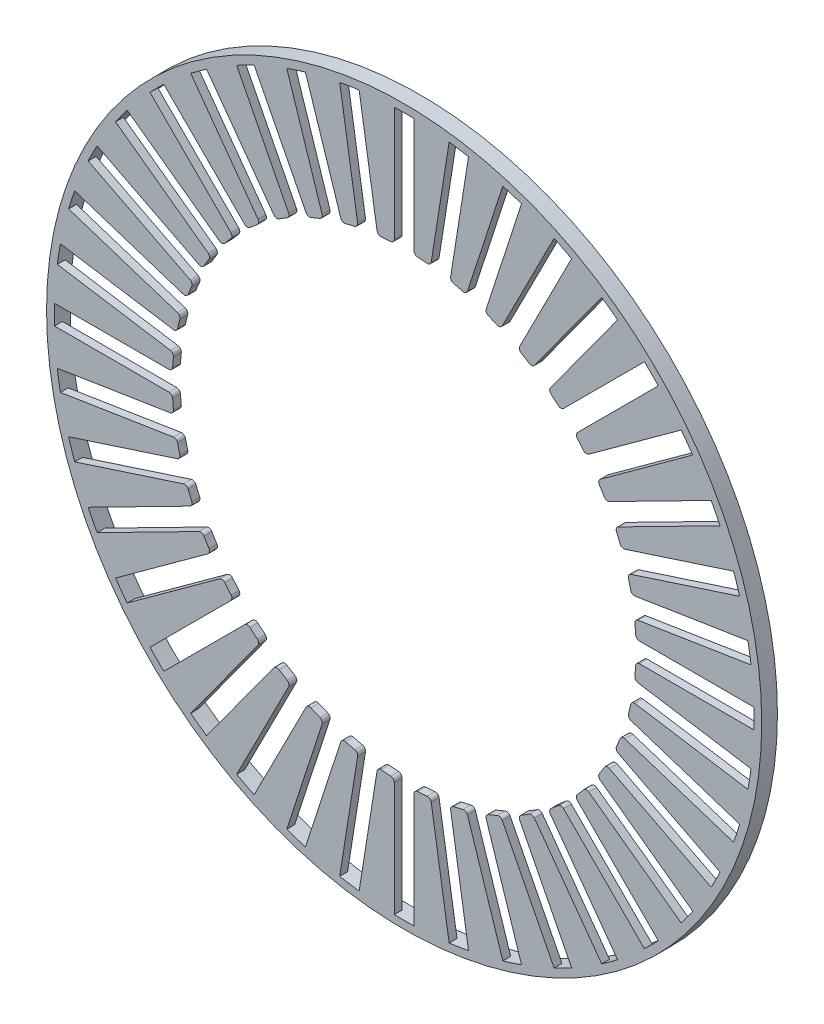
from build123d import *

# Parameters (mm, degrees)
ESQUISSE1_R        = 91
BOSS_EXTRU_1_DEPTH = 2
BOSS_EXTRU_2_START = -2
ESQUISSE1_3_R      = 91
BOSS_EXTRU_2_DEPTH = 2


with BuildPart() as part:
    # Esquisse1 → Boss.-Extru.1 (new body)
    with BuildSketch(Plane.XY):
        Circle(ESQUISSE1_R)
        with BuildLine():
            ThreePointArc((11.44795267, 88.260661564), (13.922667389, 87.904262313), (16.386394373, 87.478489239))
            Line((16.386394373, 87.478489239), (11.831455423, 58.719736546))
            ThreePointArc((11.831455423, 58.719736546), (11.997617886, 58.051361136), (12.556177327, 57.648438062))
            ThreePointArc((12.556177327, 57.648438062), (13.773276467, 57.369825303), (14.984207288, 57.065519641))
            ThreePointArc((14.984207288, 57.065519641), (15.664810641, 57.17094605), (16.116298566, 57.691036722))
            Line((16.116298566, 57.691036722), (25.114018752, 85.383172008))
            ThreePointArc((25.114018752, 85.383172008), (27.502512499, 84.64402995), (29.869301333, 83.838087036))
            Line((29.869301333, 83.838087036), (20.871581148, 56.14595175))
            ThreePointArc((20.871581148, 56.14595175), (20.931140925, 55.459811614), (21.419792516, 54.974471244))
            ThreePointArc((21.419792516, 54.974471244), (22.57832251, 54.508892418), (23.726740869, 54.018901949))
            ThreePointArc((23.726740869, 54.018901949), (24.415457189, 54.016560562), (24.942746655, 54.459619782))
            Line((24.942746655, 54.459619782), (38.161694343, 80.403265387))
            ThreePointArc((38.161694343, 80.403265387), (40.405154477, 79.299580653), (42.616726964, 78.133312888))
            Line((42.616726964, 78.133312888), (29.397779276, 52.189667283))
            ThreePointArc((29.397779276, 52.189667283), (29.349269809, 51.50265747), (29.755981326, 50.946850494))
            ThreePointArc((29.755981326, 50.946850494), (30.827415318, 50.305769697), (31.885043345, 49.642159612))
            ThreePointArc((31.885043345, 49.642159612), (32.564914151, 49.532108082), (33.15502154, 49.887226262))
            Line((33.15502154, 49.887226262), (50.269702368, 73.443563529))
            ThreePointArc((50.269702368, 73.443563529), (52.312887454, 72.002512499), (54.31478734, 70.504637267))
            Line((54.31478734, 70.504637267), (37.200106512, 46.948300001))
            ThreePointArc((37.200106512, 46.948300001), (37.044722264, 46.277336971), (37.359479122, 45.664749203))
            ThreePointArc((37.359479122, 45.664749203), (38.317434851, 44.86395197), (39.258230233, 44.043062552))
            ThreePointArc((39.258230233, 44.043062552), (39.91251485, 43.828010714), (40.55090976, 44.086443666))
            Line((40.55090976, 44.086443666), (61.139903486, 64.675437391))
            ThreePointArc((61.139903486, 64.675437391), (62.932503526, 62.932503526), (64.675437391, 61.139903486))
            Line((64.675437391, 61.139903486), (44.086443666, 40.55090976))
            ThreePointArc((44.086443666, 40.55090976), (43.828010714, 39.91251485), (44.043062552, 39.258230233))
            ThreePointArc((44.043062552, 39.258230233), (44.86395197, 38.317434851), (45.664749203, 37.359479122))
            ThreePointArc((45.664749203, 37.359479122), (46.277336971, 37.044722264), (46.948300001, 37.200106512))
            Line((46.948300001, 37.200106512), (70.504637267, 54.31478734))
            ThreePointArc((70.504637267, 54.31478734), (72.002512499, 52.312887454), (73.443563529, 50.269702368))
            Line((73.443563529, 50.269702368), (49.887226262, 33.15502154))
            ThreePointArc((49.887226262, 33.15502154), (49.532108082, 32.564914151), (49.642159612, 31.885043345))
            ThreePointArc((49.642159612, 31.885043345), (50.305769697, 30.827415318), (50.946850494, 29.755981326))
            ThreePointArc((50.946850494, 29.755981326), (51.50265747, 29.349269809), (52.189667283, 29.397779276))
            Line((52.189667283, 29.397779276), (78.133312888, 42.616726964))
            ThreePointArc((78.133312888, 42.616726964), (79.299580653, 40.405154477), (80.403265387, 38.161694343))
            Line((80.403265387, 38.161694343), (54.459619782, 24.942746655))
            ThreePointArc((54.459619782, 24.942746655), (54.016560562, 24.415457189), (54.018901949, 23.726740869))
            ThreePointArc((54.018901949, 23.726740869), (54.508892418, 22.57832251), (54.974471244, 21.419792516))
            ThreePointArc((54.974471244, 21.419792516), (55.459811614, 20.931140925), (56.14595175, 20.871581148))
            Line((56.14595175, 20.871581148), (83.838087036, 29.869301333))
            ThreePointArc((83.838087036, 29.869301333), (84.64402995, 27.502512499), (85.383172008, 25.114018752))
            Line((85.383172008, 25.114018752), (57.691036722, 16.116298566))
            ThreePointArc((57.691036722, 16.116298566), (57.17094605, 15.664810641), (57.065519641, 14.984207288))
            ThreePointArc((57.065519641, 14.984207288), (57.369825303, 13.773276468), (57.648438062, 12.556177327))
            ThreePointArc((57.648438062, 12.556177327), (58.051361136, 11.997617886), (58.719736546, 11.831455423))
            Line((58.719736546, 11.831455423), (87.478489239, 16.386394373))
            ThreePointArc((87.478489239, 16.386394373), (87.904262313, 13.922667389), (88.260661564, 11.44795267))
            Line((88.260661564, 11.44795267), (59.501908871, 6.89301372))
            ThreePointArc((59.501908871, 6.89301372), (58.917593107, 6.528444467), (58.706994851, 5.872712794))
            ThreePointArc((58.706994851, 5.872712794), (58.81812269, 4.629086648), (58.90290901, 3.383387379))
            ThreePointArc((58.90290901, 3.383387379), (59.213493486, 2.768673677), (59.847646549, 2.5))
            Line((59.847646549, 2.5), (88.964880711, 2.5))
            ThreePointArc((88.964880711, 2.5), (89, 0), (88.964880711, -2.5))
            Line((88.964880711, -2.5), (59.847646549, -2.5))
            ThreePointArc((59.847646549, -2.5), (59.213493486, -2.768673677), (58.90290901, -3.383387379))
            ThreePointArc((58.90290901, -3.383387379), (58.81812269, -4.629086648), (58.706994851, -5.872712794))
            ThreePointArc((58.706994851, -5.872712794), (58.917593108, -6.528444467), (59.501908871, -6.89301372))
            Line((59.501908871, -6.89301372), (88.260661564, -11.44795267))
            ThreePointArc((88.260661564, -11.44795267), (87.904262313, -13.922667389), (87.478489239, -16.386394373))
            Line((87.478489239, -16.386394373), (58.719736546, -11.831455423))
            ThreePointArc((58.719736546, -11.831455423), (58.051361136, -11.997617886), (57.648438062, -12.556177327))
            ThreePointArc((57.648438062, -12.556177327), (57.369825303, -13.773276467), (57.065519641, -14.984207288))
            ThreePointArc((57.065519641, -14.984207288), (57.17094605, -15.664810641), (57.691036722, -16.116298566))
            Line((57.691036722, -16.116298566), (85.383172008, -25.114018752))
            ThreePointArc((85.383172008, -25.114018752), (84.64402995, -27.502512499), (83.838087036, -29.869301333))
            Line((83.838087036, -29.869301333), (56.14595175, -20.871581148))
            ThreePointArc((56.14595175, -20.871581148), (55.459811614, -20.931140925), (54.974471244, -21.419792516))
            ThreePointArc((54.974471244, -21.419792516), (54.508892418, -22.57832251), (54.018901949, -23.726740869))
            ThreePointArc((54.018901949, -23.726740869), (54.016560562, -24.415457189), (54.459619782, -24.942746655))
            Line((54.459619782, -24.942746655), (80.403265387, -38.161694343))
            ThreePointArc((80.403265387, -38.161694343), (79.299580653, -40.405154477), (78.133312888, -42.616726964))
            Line((78.133312888, -42.616726964), (52.189667283, -29.397779276))
            ThreePointArc((52.189667283, -29.397779276), (51.50265747, -29.349269809), (50.946850494, -29.755981326))
            ThreePointArc((50.946850494, -29.755981326), (50.305769697, -30.827415318), (49.642159612, -31.885043345))
            ThreePointArc((49.642159612, -31.885043345), (49.532108082, -32.564914151), (49.887226262, -33.15502154))
            Line((49.887226262, -33.15502154), (73.443563529, -50.269702368))
            ThreePointArc((73.443563529, -50.269702368), (72.002512499, -52.312887454), (70.504637267, -54.31478734))
            Line((70.504637267, -54.31478734), (46.948300001, -37.200106512))
            ThreePointArc((46.948300001, -37.200106512), (46.277336971, -37.044722264), (45.664749203, -37.359479122))
            ThreePointArc((45.664749203, -37.359479122), (44.86395197, -38.317434851), (44.043062552, -39.258230233))
            ThreePointArc((44.043062552, -39.258230233), (43.828010714, -39.91251485), (44.086443666, -40.55090976))
            Line((44.086443666, -40.55090976), (64.675437391, -61.139903486))
            ThreePointArc((64.675437391, -61.139903486), (62.932503526, -62.932503526), (61.139903486, -64.675437391))
            Line((61.139903486, -64.675437391), (40.55090976, -44.086443666))
            ThreePointArc((40.55090976, -44.086443666), (39.91251485, -43.828010714), (39.258230233, -44.043062552))
            ThreePointArc((39.258230233, -44.043062552), (38.317434851, -44.86395197), (37.359479122, -45.664749203))
            ThreePointArc((37.359479122, -45.664749203), (37.044722264, -46.277336971), (37.200106512, -46.948300001))
            Line((37.200106512, -46.948300001), (54.31478734, -70.504637267))
            ThreePointArc((54.31478734, -70.504637267), (52.312887454, -72.002512499), (50.269702368, -73.443563529))
            Line((50.269702368, -73.443563529), (33.15502154, -49.887226262))
            ThreePointArc((33.15502154, -49.887226262), (32.564914151, -49.532108082), (31.885043345, -49.642159612))
            ThreePointArc((31.885043345, -49.642159612), (30.827415318, -50.305769697), (29.755981326, -50.946850494))
            ThreePointArc((29.755981326, -50.946850494), (29.349269809, -51.50265747), (29.397779276, -52.189667283))
            Line((29.397779276, -52.189667283), (42.616726964, -78.133312888))
            ThreePointArc((42.616726964, -78.133312888), (40.405154477, -79.299580653), (38.161694343, -80.403265387))
            Line((38.161694343, -80.403265387), (24.942746655, -54.459619782))
            ThreePointArc((24.942746655, -54.459619782), (24.415457189, -54.016560562), (23.726740869, -54.018901949))
            ThreePointArc((23.726740869, -54.018901949), (22.57832251, -54.508892418), (21.419792516, -54.974471244))
            ThreePointArc((21.419792516, -54.974471244), (20.931140925, -55.459811614), (20.871581148, -56.14595175))
            Line((20.871581148, -56.14595175), (29.869301333, -83.838087036))
            ThreePointArc((29.869301333, -83.838087036), (27.502512499, -84.64402995), (25.114018752, -85.383172008))
            Line((25.114018752, -85.383172008), (16.116298566, -57.691036722))
            ThreePointArc((16.116298566, -57.691036722), (15.664810641, -57.17094605), (14.984207288, -57.065519641))
            ThreePointArc((14.984207288, -57.065519641), (13.773276468, -57.369825303), (12.556177327, -57.648438062))
            ThreePointArc((12.556177327, -57.648438062), (11.997617886, -58.051361136), (11.831455423, -58.719736546))
            Line((11.831455423, -58.719736546), (16.386394373, -87.478489239))
            ThreePointArc((16.386394373, -87.478489239), (13.922667389, -87.904262313), (11.44795267, -88.260661564))
            Line((11.44795267, -88.260661564), (6.89301372, -59.501908871))
            ThreePointArc((6.89301372, -59.501908871), (6.528444467, -58.917593107), (5.872712794, -58.706994851))
            ThreePointArc((5.872712794, -58.706994851), (4.629086648, -58.81812269), (3.383387379, -58.90290901))
            ThreePointArc((3.383387379, -58.90290901), (2.768673677, -59.213493486), (2.5, -59.847646549))
            Line((2.5, -59.847646549), (2.5, -88.964880711))
            ThreePointArc((2.5, -88.964880711), (0, -89), (-2.5, -88.964880711))
            Line((-2.5, -88.964880711), (-2.5, -59.847646549))
            ThreePointArc((-2.5, -59.847646549), (-2.768673677, -59.213493486), (-3.383387379, -58.90290901))
            ThreePointArc((-3.383387379, -58.90290901), (-4.629086648, -58.81812269), (-5.872712794, -58.706994851))
            ThreePointArc((-5.872712794, -58.706994851), (-6.528444467, -58.917593108), (-6.89301372, -59.501908871))
            Line((-6.89301372, -59.501908871), (-11.44795267, -88.260661564))
            ThreePointArc((-11.44795267, -88.260661564), (-13.922667389, -87.904262313), (-16.386394373, -87.478489239))
            Line((-16.386394373, -87.478489239), (-11.831455423, -58.719736546))
            ThreePointArc((-11.831455423, -58.719736546), (-11.997617886, -58.051361136), (-12.556177326, -57.648438062))
            ThreePointArc((-12.556177326, -57.648438062), (-13.773276467, -57.369825303), (-14.984207288, -57.065519641))
            ThreePointArc((-14.984207288, -57.065519641), (-15.664810641, -57.17094605), (-16.116298566, -57.691036722))
            Line((-16.116298566, -57.691036722), (-25.114018752, -85.383172008))
            ThreePointArc((-25.114018752, -85.383172008), (-27.502512499, -84.64402995), (-29.869301333, -83.838087036))
            Line((-29.869301333, -83.838087036), (-20.871581148, -56.14595175))
            ThreePointArc((-20.871581148, -56.14595175), (-20.931140925, -55.459811614), (-21.419792516, -54.974471244))
            ThreePointArc((-21.419792516, -54.974471244), (-22.57832251, -54.508892418), (-23.726740869, -54.018901949))
            ThreePointArc((-23.726740869, -54.018901949), (-24.415457189, -54.016560562), (-24.942746655, -54.459619782))
            Line((-24.942746655, -54.459619782), (-38.161694343, -80.403265387))
            ThreePointArc((-38.161694343, -80.403265387), (-40.405154477, -79.299580653), (-42.616726964, -78.133312888))
            Line((-42.616726964, -78.133312888), (-29.397779276, -52.189667283))
            ThreePointArc((-29.397779276, -52.189667283), (-29.349269809, -51.50265747), (-29.755981326, -50.946850494))
            ThreePointArc((-29.755981326, -50.946850494), (-30.827415318, -50.305769697), (-31.885043345, -49.642159612))
            ThreePointArc((-31.885043345, -49.642159612), (-32.564914151, -49.532108082), (-33.15502154, -49.887226263))
            Line((-33.15502154, -49.887226263), (-50.269702368, -73.443563529))
            ThreePointArc((-50.269702368, -73.443563529), (-52.312887454, -72.002512499), (-54.31478734, -70.504637267))
            Line((-54.31478734, -70.504637267), (-37.200106512, -46.948300001))
            ThreePointArc((-37.200106512, -46.948300001), (-37.044722264, -46.277336971), (-37.359479122, -45.664749203))
            ThreePointArc((-37.359479122, -45.664749203), (-38.317434851, -44.86395197), (-39.258230233, -44.043062552))
            ThreePointArc((-39.258230233, -44.043062552), (-39.91251485, -43.828010714), (-40.55090976, -44.086443666))
            Line((-40.55090976, -44.086443666), (-61.139903486, -64.675437391))
            ThreePointArc((-61.139903486, -64.675437391), (-62.932503526, -62.932503526), (-64.675437391, -61.139903486))
            Line((-64.675437391, -61.139903486), (-44.086443666, -40.55090976))
            ThreePointArc((-44.086443666, -40.55090976), (-43.828010714, -39.91251485), (-44.043062552, -39.258230233))
            ThreePointArc((-44.043062552, -39.258230233), (-44.86395197, -38.317434851), (-45.664749203, -37.359479122))
            ThreePointArc((-45.664749203, -37.359479122), (-46.277336971, -37.044722264), (-46.948300001, -37.200106512))
            Line((-46.948300001, -37.200106512), (-70.504637267, -54.31478734))
            ThreePointArc((-70.504637267, -54.31478734), (-72.002512499, -52.312887454), (-73.443563529, -50.269702368))
            Line((-73.443563529, -50.269702368), (-49.887226262, -33.15502154))
            ThreePointArc((-49.887226262, -33.15502154), (-49.532108082, -32.564914151), (-49.642159612, -31.885043345))
            ThreePointArc((-49.642159612, -31.885043345), (-50.305769697, -30.827415318), (-50.946850494, -29.755981326))
            ThreePointArc((-50.946850494, -29.755981326), (-51.50265747, -29.349269809), (-52.189667283, -29.397779276))
            Line((-52.189667283, -29.397779276), (-78.133312888, -42.616726964))
            ThreePointArc((-78.133312888, -42.616726964), (-79.299580653, -40.405154477), (-80.403265387, -38.161694343))
            Line((-80.403265387, -38.161694343), (-54.459619782, -24.942746655))
            ThreePointArc((-54.459619782, -24.942746655), (-54.016560562, -24.415457189), (-54.018901949, -23.726740869))
            ThreePointArc((-54.018901949, -23.726740869), (-54.508892418, -22.57832251), (-54.974471244, -21.419792516))
            ThreePointArc((-54.974471244, -21.419792516), (-55.459811614, -20.931140925), (-56.14595175, -20.871581148))
            Line((-56.14595175, -20.871581148), (-83.838087036, -29.869301333))
            ThreePointArc((-83.838087036, -29.869301333), (-84.64402995, -27.502512499), (-85.383172008, -25.114018752))
            Line((-85.383172008, -25.114018752), (-57.691036722, -16.116298566))
            ThreePointArc((-57.691036722, -16.116298566), (-57.17094605, -15.664810641), (-57.065519641, -14.984207288))
            ThreePointArc((-57.065519641, -14.984207288), (-57.369825303, -13.773276468), (-57.648438062, -12.556177326))
            ThreePointArc((-57.648438062, -12.556177326), (-58.051361136, -11.997617886), (-58.719736546, -11.831455423))
            Line((-58.719736546, -11.831455423), (-87.478489239, -16.386394373))
            ThreePointArc((-87.478489239, -16.386394373), (-87.904262313, -13.922667389), (-88.260661564, -11.44795267))
            Line((-88.260661564, -11.44795267), (-59.501908871, -6.89301372))
            ThreePointArc((-59.501908871, -6.89301372), (-58.917593108, -6.528444467), (-58.706994851, -5.872712794))
            ThreePointArc((-58.706994851, -5.872712794), (-58.81812269, -4.629086648), (-58.90290901, -3.383387379))
            ThreePointArc((-58.90290901, -3.383387379), (-59.213493486, -2.768673677), (-59.847646549, -2.5))
            Line((-59.847646549, -2.5), (-88.964880711, -2.5))
            ThreePointArc((-88.964880711, -2.5), (-89, 0), (-88.964880711, 2.5))
            Line((-88.964880711, 2.5), (-59.847646549, 2.5))
            ThreePointArc((-59.847646549, 2.5), (-59.213493486, 2.768673677), (-58.90290901, 3.383387379))
            ThreePointArc((-58.90290901, 3.383387379), (-58.81812269, 4.629086648), (-58.706994851, 5.872712794))
            ThreePointArc((-58.706994851, 5.872712794), (-58.917593108, 6.528444467), (-59.501908871, 6.89301372))
            Line((-59.501908871, 6.89301372), (-88.260661564, 11.44795267))
            ThreePointArc((-88.260661564, 11.44795267), (-87.904262313, 13.922667389), (-87.478489239, 16.386394373))
            Line((-87.478489239, 16.386394373), (-58.719736546, 11.831455423))
            ThreePointArc((-58.719736546, 11.831455423), (-58.051361136, 11.997617886), (-57.648438062, 12.556177326))
            ThreePointArc((-57.648438062, 12.556177326), (-57.369825303, 13.773276467), (-57.065519641, 14.984207288))
            ThreePointArc((-57.065519641, 14.984207288), (-57.17094605, 15.664810642), (-57.691036722, 16.116298566))
            Line((-57.691036722, 16.116298566), (-85.383172008, 25.114018752))
            ThreePointArc((-85.383172008, 25.114018752), (-84.64402995, 27.502512499), (-83.838087036, 29.869301333))
            Line((-83.838087036, 29.869301333), (-56.14595175, 20.871581148))
            ThreePointArc((-56.14595175, 20.871581148), (-55.459811614, 20.931140925), (-54.974471244, 21.419792516))
            ThreePointArc((-54.974471244, 21.419792516), (-54.508892418, 22.57832251), (-54.018901949, 23.726740869))
            ThreePointArc((-54.018901949, 23.726740869), (-54.016560562, 24.415457189), (-54.459619782, 24.942746655))
            Line((-54.459619782, 24.942746655), (-80.403265387, 38.161694343))
            ThreePointArc((-80.403265387, 38.161694343), (-79.299580653, 40.405154477), (-78.133312888, 42.616726964))
            Line((-78.133312888, 42.616726964), (-52.189667283, 29.397779276))
            ThreePointArc((-52.189667283, 29.397779276), (-51.50265747, 29.349269809), (-50.946850494, 29.755981326))
            ThreePointArc((-50.946850494, 29.755981326), (-50.305769697, 30.827415318), (-49.642159612, 31.885043345))
            ThreePointArc((-49.642159612, 31.885043345), (-49.532108082, 32.564914151), (-49.887226262, 33.15502154))
            Line((-49.887226262, 33.15502154), (-73.443563529, 50.269702368))
            ThreePointArc((-73.443563529, 50.269702368), (-72.002512499, 52.312887454), (-70.504637267, 54.31478734))
            Line((-70.504637267, 54.31478734), (-46.948300001, 37.200106512))
            ThreePointArc((-46.948300001, 37.200106512), (-46.277336971, 37.044722264), (-45.664749203, 37.359479122))
            ThreePointArc((-45.664749203, 37.359479122), (-44.86395197, 38.317434851), (-44.043062552, 39.258230233))
            ThreePointArc((-44.043062552, 39.258230233), (-43.828010714, 39.91251485), (-44.086443666, 40.55090976))
            Line((-44.086443666, 40.55090976), (-64.675437391, 61.139903486))
            ThreePointArc((-64.675437391, 61.139903486), (-62.932503526, 62.932503526), (-61.139903486, 64.675437391))
            Line((-61.139903486, 64.675437391), (-40.55090976, 44.086443666))
            ThreePointArc((-40.55090976, 44.086443666), (-39.91251485, 43.828010714), (-39.258230233, 44.043062552))
            ThreePointArc((-39.258230233, 44.043062552), (-38.317434851, 44.86395197), (-37.359479122, 45.664749203))
            ThreePointArc((-37.359479122, 45.664749203), (-37.044722264, 46.277336971), (-37.200106512, 46.948300001))
            Line((-37.200106512, 46.948300001), (-54.31478734, 70.504637267))
            ThreePointArc((-54.31478734, 70.504637267), (-52.312887454, 72.002512499), (-50.269702368, 73.443563529))
            Line((-50.269702368, 73.443563529), (-33.15502154, 49.887226262))
            ThreePointArc((-33.15502154, 49.887226262), (-32.564914151, 49.532108082), (-31.885043345, 49.642159612))
            ThreePointArc((-31.885043345, 49.642159612), (-30.827415318, 50.305769697), (-29.755981326, 50.946850494))
            ThreePointArc((-29.755981326, 50.946850494), (-29.349269809, 51.50265747), (-29.397779276, 52.189667283))
            Line((-29.397779276, 52.189667283), (-42.616726964, 78.133312888))
            ThreePointArc((-42.616726964, 78.133312888), (-40.405154477, 79.299580653), (-38.161694343, 80.403265387))
            Line((-38.161694343, 80.403265387), (-24.942746655, 54.459619782))
            ThreePointArc((-24.942746655, 54.459619782), (-24.415457189, 54.016560562), (-23.726740869, 54.018901949))
            ThreePointArc((-23.726740869, 54.018901949), (-22.57832251, 54.508892418), (-21.419792516, 54.974471244))
            ThreePointArc((-21.419792516, 54.974471244), (-20.931140925, 55.459811614), (-20.871581148, 56.14595175))
            Line((-20.871581148, 56.14595175), (-29.869301333, 83.838087036))
            ThreePointArc((-29.869301333, 83.838087036), (-27.502512499, 84.64402995), (-25.114018752, 85.383172008))
            Line((-25.114018752, 85.383172008), (-16.116298566, 57.691036722))
            ThreePointArc((-16.116298566, 57.691036722), (-15.664810641, 57.17094605), (-14.984207288, 57.065519641))
            ThreePointArc((-14.984207288, 57.065519641), (-13.773276467, 57.369825303), (-12.556177327, 57.648438062))
            ThreePointArc((-12.556177327, 57.648438062), (-11.997617886, 58.051361136), (-11.831455423, 58.719736546))
            Line((-11.831455423, 58.719736546), (-16.386394373, 87.478489239))
            ThreePointArc((-16.386394373, 87.478489239), (-13.922667389, 87.904262313), (-11.44795267, 88.260661564))
            Line((-11.44795267, 88.260661564), (-6.89301372, 59.501908871))
            ThreePointArc((-6.89301372, 59.501908871), (-6.528444467, 58.917593108), (-5.872712794, 58.706994851))
            ThreePointArc((-5.872712794, 58.706994851), (-4.629086648, 58.81812269), (-3.383387379, 58.90290901))
            ThreePointArc((-3.383387379, 58.90290901), (-2.768673677, 59.213493486), (-2.5, 59.847646549))
            Line((-2.5, 59.847646549), (-2.5, 88.964880711))
            ThreePointArc((-2.5, 88.964880711), (0, 89), (2.5, 88.964880711))
            Line((2.5, 88.964880711), (2.5, 59.847646549))
            ThreePointArc((2.5, 59.847646549), (2.768673677, 59.213493486), (3.383387379, 58.90290901))
            ThreePointArc((3.383387379, 58.90290901), (4.629086648, 58.81812269), (5.872712794, 58.706994851))
            ThreePointArc((5.872712794, 58.706994851), (6.528444467, 58.917593108), (6.89301372, 59.501908871))
            Line((6.89301372, 59.501908871), (11.44795267, 88.260661564))
        make_face(mode=Mode.SUBTRACT)
    extrude(amount=BOSS_EXTRU_1_DEPTH)

    # Esquisse1<3> → Boss.-Extru.2 (add)
    with BuildSketch(Plane.XY.offset(BOSS_EXTRU_2_START)):
        Circle(ESQUISSE1_3_R)
        with BuildLine():
            ThreePointArc((2.5, 88.964880711), (6.98285952, 88.725642702), (11.44795267, 88.260661564))
            ThreePointArc((11.44795267, 88.260661564), (13.922667389, 87.904262313), (16.386394373, 87.478489239))
            ThreePointArc((16.386394373, 87.478489239), (20.776637383, 86.540922915), (25.114018752, 85.383172008))
            ThreePointArc((25.114018752, 85.383172008), (27.502512499, 84.64402995), (29.869301333, 83.838087036))
            ThreePointArc((29.869301333, 83.838087036), (34.05882548, 82.225278394), (38.161694343, 80.403265387))
            ThreePointArc((38.161694343, 80.403265387), (40.405154477, 79.299580653), (42.616726964, 78.133312888))
            ThreePointArc((42.616726964, 78.133312888), (46.50237226, 75.884974628), (50.269702368, 73.443563529))
            ThreePointArc((50.269702368, 73.443563529), (52.312887454, 72.002512499), (54.31478734, 70.504637267))
            ThreePointArc((54.31478734, 70.504637267), (57.800876301, 67.676130938), (61.139903486, 64.675437391))
            ThreePointArc((61.139903486, 64.675437391), (62.932503526, 62.932503526), (64.675437391, 61.139903486))
            ThreePointArc((64.675437391, 61.139903486), (67.676130938, 57.800876301), (70.504637267, 54.31478734))
            ThreePointArc((70.504637267, 54.31478734), (72.002512499, 52.312887454), (73.443563529, 50.269702368))
            ThreePointArc((73.443563529, 50.269702368), (75.884974628, 46.50237226), (78.133312888, 42.616726964))
            ThreePointArc((78.133312888, 42.616726964), (79.299580653, 40.405154477), (80.403265387, 38.161694343))
            ThreePointArc((80.403265387, 38.161694343), (82.225278394, 34.05882548), (83.838087036, 29.869301333))
            ThreePointArc((83.838087036, 29.869301333), (84.64402995, 27.502512499), (85.383172008, 25.114018752))
            ThreePointArc((85.383172008, 25.114018752), (86.540922915, 20.776637383), (87.478489239, 16.386394373))
            ThreePointArc((87.478489239, 16.386394373), (87.904262313, 13.922667389), (88.260661564, 11.44795267))
            ThreePointArc((88.260661564, 11.44795267), (88.725642702, 6.98285952), (88.964880711, 2.5))
            ThreePointArc((88.964880711, 2.5), (88.991219745, 1.25012333), (89, 0))
            ThreePointArc((89, 0), (88.991219745, -1.25012333), (88.964880711, -2.5))
            ThreePointArc((88.964880711, -2.5), (88.725642702, -6.98285952), (88.260661564, -11.44795267))
            ThreePointArc((88.260661564, -11.44795267), (87.904262313, -13.922667389), (87.478489239, -16.386394373))
            ThreePointArc((87.478489239, -16.386394373), (86.540922915, -20.776637383), (85.383172008, -25.114018752))
            ThreePointArc((85.383172008, -25.114018752), (84.64402995, -27.502512499), (83.838087036, -29.869301333))
            ThreePointArc((83.838087036, -29.869301333), (82.225278394, -34.05882548), (80.403265387, -38.161694343))
            ThreePointArc((80.403265387, -38.161694343), (79.299580653, -40.405154477), (78.133312888, -42.616726964))
            ThreePointArc((78.133312888, -42.616726964), (75.884974628, -46.50237226), (73.443563529, -50.269702368))
            ThreePointArc((73.443563529, -50.269702368), (72.002512499, -52.312887454), (70.504637267, -54.31478734))
            ThreePointArc((70.504637267, -54.31478734), (67.676130938, -57.800876301), (64.675437391, -61.139903486))
            ThreePointArc((64.675437391, -61.139903486), (62.932503526, -62.932503526), (61.139903486, -64.675437391))
            ThreePointArc((61.139903486, -64.675437391), (57.800876301, -67.676130938), (54.31478734, -70.504637267))
            ThreePointArc((54.31478734, -70.504637267), (52.312887454, -72.002512499), (50.269702368, -73.443563529))
            ThreePointArc((50.269702368, -73.443563529), (46.50237226, -75.884974628), (42.616726964, -78.133312888))
            ThreePointArc((42.616726964, -78.133312888), (40.405154477, -79.299580653), (38.161694343, -80.403265387))
            ThreePointArc((38.161694343, -80.403265387), (34.05882548, -82.225278394), (29.869301333, -83.838087036))
            ThreePointArc((29.869301333, -83.838087036), (27.502512499, -84.64402995), (25.114018752, -85.383172008))
            ThreePointArc((25.114018752, -85.383172008), (20.776637383, -86.540922915), (16.386394373, -87.478489239))
            ThreePointArc((16.386394373, -87.478489239), (13.922667389, -87.904262313), (11.44795267, -88.260661564))
            ThreePointArc((11.44795267, -88.260661564), (6.98285952, -88.725642702), (2.5, -88.964880711))
            ThreePointArc((2.5, -88.964880711), (0, -89), (-2.5, -88.964880711))
            ThreePointArc((-2.5, -88.964880711), (-6.98285952, -88.725642702), (-11.44795267, -88.260661564))
            ThreePointArc((-11.44795267, -88.260661564), (-13.922667389, -87.904262313), (-16.386394373, -87.478489239))
            ThreePointArc((-16.386394373, -87.478489239), (-20.776637383, -86.540922915), (-25.114018752, -85.383172008))
            ThreePointArc((-25.114018752, -85.383172008), (-27.502512499, -84.64402995), (-29.869301333, -83.838087036))
            ThreePointArc((-29.869301333, -83.838087036), (-34.05882548, -82.225278394), (-38.161694343, -80.403265387))
            ThreePointArc((-38.161694343, -80.403265387), (-40.405154477, -79.299580653), (-42.616726964, -78.133312888))
            ThreePointArc((-42.616726964, -78.133312888), (-46.50237226, -75.884974628), (-50.269702368, -73.443563529))
            ThreePointArc((-50.269702368, -73.443563529), (-52.312887454, -72.002512499), (-54.31478734, -70.504637267))
            ThreePointArc((-54.31478734, -70.504637267), (-57.800876301, -67.676130938), (-61.139903486, -64.675437391))
            ThreePointArc((-61.139903486, -64.675437391), (-62.932503526, -62.932503526), (-64.675437391, -61.139903486))
            ThreePointArc((-64.675437391, -61.139903486), (-67.676130938, -57.800876301), (-70.504637267, -54.31478734))
            ThreePointArc((-70.504637267, -54.31478734), (-72.002512499, -52.312887454), (-73.443563529, -50.269702368))
            ThreePointArc((-73.443563529, -50.269702368), (-75.884974628, -46.50237226), (-78.133312888, -42.616726964))
            ThreePointArc((-78.133312888, -42.616726964), (-79.299580653, -40.405154477), (-80.403265387, -38.161694343))
            ThreePointArc((-80.403265387, -38.161694343), (-82.225278394, -34.05882548), (-83.838087036, -29.869301333))
            ThreePointArc((-83.838087036, -29.869301333), (-84.64402995, -27.502512499), (-85.383172008, -25.114018752))
            ThreePointArc((-85.383172008, -25.114018752), (-86.540922915, -20.776637383), (-87.478489239, -16.386394373))
            ThreePointArc((-87.478489239, -16.386394373), (-87.904262313, -13.922667389), (-88.260661564, -11.44795267))
            ThreePointArc((-88.260661564, -11.44795267), (-88.725642702, -6.98285952), (-88.964880711, -2.5))
            ThreePointArc((-88.964880711, -2.5), (-89, 0), (-88.964880711, 2.5))
            ThreePointArc((-88.964880711, 2.5), (-88.725642702, 6.98285952), (-88.260661564, 11.44795267))
            ThreePointArc((-88.260661564, 11.44795267), (-87.904262313, 13.922667389), (-87.478489239, 16.386394373))
            ThreePointArc((-87.478489239, 16.386394373), (-86.540922915, 20.776637383), (-85.383172008, 25.114018752))
            ThreePointArc((-85.383172008, 25.114018752), (-84.64402995, 27.502512499), (-83.838087036, 29.869301333))
            ThreePointArc((-83.838087036, 29.869301333), (-82.225278394, 34.05882548), (-80.403265387, 38.161694343))
            ThreePointArc((-80.403265387, 38.161694343), (-79.299580653, 40.405154477), (-78.133312888, 42.616726964))
            ThreePointArc((-78.133312888, 42.616726964), (-75.884974628, 46.50237226), (-73.443563529, 50.269702368))
            ThreePointArc((-73.443563529, 50.269702368), (-72.002512499, 52.312887454), (-70.504637267, 54.31478734))
            ThreePointArc((-70.504637267, 54.31478734), (-67.676130938, 57.800876301), (-64.675437391, 61.139903486))
            ThreePointArc((-64.675437391, 61.139903486), (-62.932503526, 62.932503526), (-61.139903486, 64.675437391))
            ThreePointArc((-61.139903486, 64.675437391), (-57.800876301, 67.676130938), (-54.31478734, 70.504637267))
            ThreePointArc((-54.31478734, 70.504637267), (-52.312887454, 72.002512499), (-50.269702368, 73.443563529))
            ThreePointArc((-50.269702368, 73.443563529), (-46.50237226, 75.884974628), (-42.616726964, 78.133312888))
            ThreePointArc((-42.616726964, 78.133312888), (-40.405154477, 79.299580653), (-38.161694343, 80.403265387))
            ThreePointArc((-38.161694343, 80.403265387), (-34.05882548, 82.225278394), (-29.869301333, 83.838087036))
            ThreePointArc((-29.869301333, 83.838087036), (-27.502512499, 84.64402995), (-25.114018752, 85.383172008))
            ThreePointArc((-25.114018752, 85.383172008), (-20.776637383, 86.540922915), (-16.386394373, 87.478489239))
            ThreePointArc((-16.386394373, 87.478489239), (-13.922667389, 87.904262313), (-11.44795267, 88.260661564))
            ThreePointArc((-11.44795267, 88.260661564), (-6.98285952, 88.725642702), (-2.5, 88.964880711))
            ThreePointArc((-2.5, 88.964880711), (0, 89), (2.5, 88.964880711))
        make_face(mode=Mode.SUBTRACT)
    extrude(amount=BOSS_EXTRU_2_DEPTH)


solid = part.part
